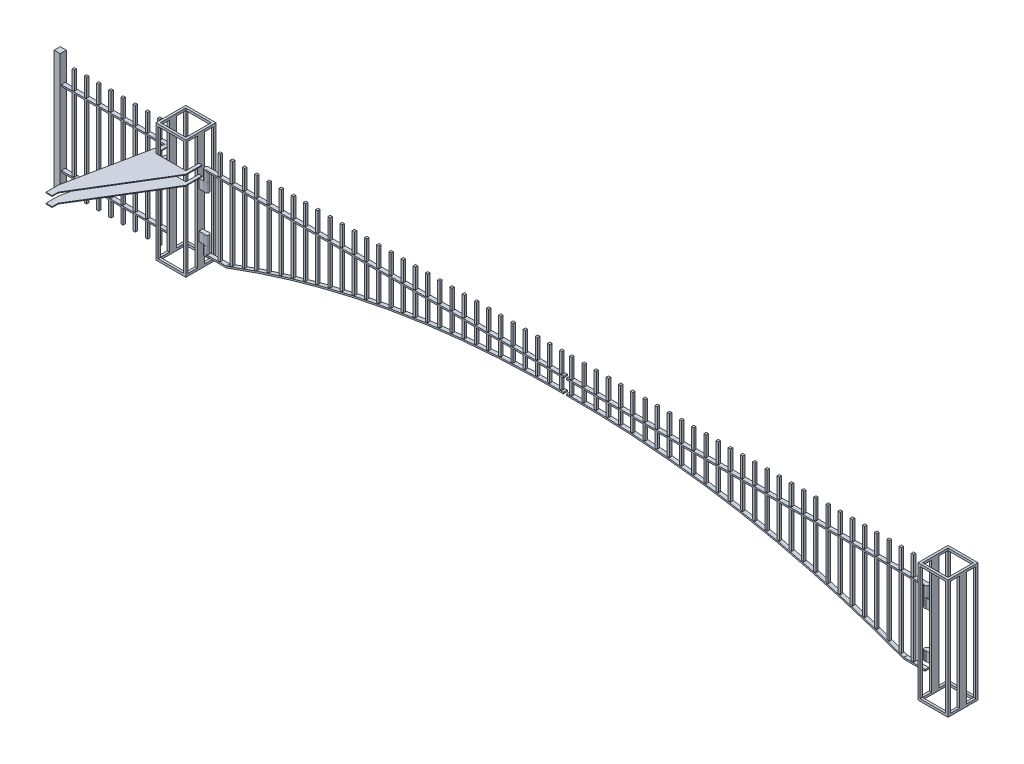
from build123d import *

# Parameters (mm, degrees)
SKETCH1_W                 = 19.05
SKETCH1_H                 = 60
BOSS_EXTRUDE1_DEPTH       = 990.6
SKETCH1_H_2               = 19.05
BOSS_EXTRUDE1_2_DEPTH     = 990.6
BOSS_EXTRUDE1_3_DEPTH     = 990.6
BOSS_EXTRUDE1_4_DEPTH     = 990.6
BOSS_EXTRUDE1_5_DEPTH     = 990.6
BOSS_EXTRUDE1_6_DEPTH     = 990.6
SKETCH1_W_2               = 50.8
SKETCH1_H_3               = 50.8
BOSS_EXTRUDE1_7_DEPTH     = 990.6
BOSS_EXTRUDE2_START       = 971.55
BOSS_EXTRUDE2_OUTLINE_W   = 211.9
BOSS_EXTRUDE2_OUTLINE_H   = 19.05
BOSS_EXTRUDE2_OUTLINE_W_2 = 19.05
BOSS_EXTRUDE2_OUTLINE_H_2 = 75.95
BOSS_EXTRUDE2_DEPTH       = 19.05
SKETCH1_4_W               = 250
SKETCH1_4_H               = 250
SKETCH1_4_W_2             = 211.9
SKETCH1_4_H_2             = 211.9
BOSS_EXTRUDE3_DEPTH       = 19.05
SKETCH1_5_W               = 19.05
SKETCH1_5_H               = 19.05
BOSS_EXTRUDE4_DEPTH       = 914.4
BOSS_EXTRUDE4_2_DEPTH     = 914.4
BOSS_EXTRUDE4_3_DEPTH     = 914.4
BOSS_EXTRUDE4_4_DEPTH     = 914.4
BOSS_EXTRUDE4_5_DEPTH     = 914.4
BOSS_EXTRUDE4_6_DEPTH     = 914.4
BOSS_EXTRUDE4_7_DEPTH     = 914.4
BOSS_EXTRUDE4_8_DEPTH     = 914.4
BOSS_EXTRUDE5_START       = 130
SKETCH2_W                 = 895.35
SKETCH2_H                 = 31.75
BOSS_EXTRUDE5_DEPTH       = 12.7
BOSS_EXTRUDE6_START       = 750
SKETCH2_2_W               = 895.35
SKETCH2_2_H               = 31.75
BOSS_EXTRUDE6_DEPTH       = 12.7
BOSS_EXTRUDE7_START       = -406.4
BOSS_EXTRUDE7_DEPTH       = 76.2
BOSS_EXTRUDE11_START      = -787.4
BOSS_EXTRUDE11_DEPTH      = 76.2
BOSS_EXTRUDE8_START       = -330.2
SKETCH5_3_R               = 19.05
BOSS_EXTRUDE8_DEPTH       = 76.2
BOSS_EXTRUDE12_START      = -787.4
SKETCH5_7_R               = 19.05
BOSS_EXTRUDE12_DEPTH      = 76.2
BOSS_EXTRUDE9_START       = -254
SKETCH5_4_W               = 19.05
SKETCH5_4_H               = 19.05
BOSS_EXTRUDE9_DEPTH       = 12.7
EXTRUDE_THIN1_START       = -15.875
EXTRUDE_THIN1_DEPTH       = 31.75
BOSS_EXTRUDE10_START      = -76.2
SKETCH5_5_W               = 19.05
SKETCH5_5_H               = 19.05
BOSS_EXTRUDE10_DEPTH      = 914.4
CUT_EXTRUDE1_DEPTH        = 4361.014057603
CUT_EXTRUDE1_DEPTH_BACK   = 4361.014057603
BOSS_EXTRUDE14_DEPTH      = 6.35
BOSS_EXTRUDE15_START      = -73.5
BOSS_EXTRUDE15_DEPTH      = 6.35


# Read off the part's stored shape, not the designer's step: Boss-Extrude2, Extrude-Thin1
with BuildPart() as part:
    # Sketch1 → Boss-Extrude1 (new body)
    with BuildSketch(Plane(origin=(0, 0, 0), x_dir=(1, 0, 0), z_dir=(0, 1, 0))):
        with Locations((-3288.475, 0)):
            Rectangle(SKETCH1_W, SKETCH1_H)
    extrude(amount=BOSS_EXTRUDE1_DEPTH)



with BuildPart() as body_2:
    # Sketch1 → Boss-Extrude1 2 (new body)
    with BuildSketch(Plane(origin=(0, 0, 0), x_dir=(1, 0, 0), z_dir=(0, 1, 0))):
        with Locations((-3288.475, 115.475)):
            Rectangle(SKETCH1_W, SKETCH1_H_2)
    extrude(amount=BOSS_EXTRUDE1_2_DEPTH)


with BuildPart() as body_3:
    # Sketch1 → Boss-Extrude1 3 (new body)
    with BuildSketch(Plane(origin=(0, 0, 0), x_dir=(1, 0, 0), z_dir=(0, 1, 0))):
        with Locations((-3288.475, -115.475)):
            Rectangle(SKETCH1_W, SKETCH1_H_2)
    extrude(amount=BOSS_EXTRUDE1_3_DEPTH)


with BuildPart() as body_4:
    # Sketch1 → Boss-Extrude1 4 (new body)
    with BuildSketch(Plane(origin=(0, 0, 0), x_dir=(1, 0, 0), z_dir=(0, 1, 0))):
        with Locations((-3057.525, 115.475)):
            Rectangle(SKETCH1_W, SKETCH1_H_2)
    extrude(amount=BOSS_EXTRUDE1_4_DEPTH)


with BuildPart() as body_5:
    # Sketch1 → Boss-Extrude1 5 (new body)
    with BuildSketch(Plane(origin=(0, 0, 0), x_dir=(1, 0, 0), z_dir=(0, 1, 0))):
        with Locations((-3057.525, 0)):
            Rectangle(SKETCH1_W, SKETCH1_H)
    extrude(amount=BOSS_EXTRUDE1_5_DEPTH)


with BuildPart() as body_6:
    # Sketch1 → Boss-Extrude1 6 (new body)
    with BuildSketch(Plane(origin=(0, 0, 0), x_dir=(1, 0, 0), z_dir=(0, 1, 0))):
        with Locations((-3057.525, -115.475)):
            Rectangle(SKETCH1_W, SKETCH1_H_2)
    extrude(amount=BOSS_EXTRUDE1_6_DEPTH)


with BuildPart() as body_7:
    # Sketch1 → Boss-Extrude1 7 (new body)
    with BuildSketch(Plane(origin=(0, 0, 0), x_dir=(1, 0, 0), z_dir=(0, 1, 0))):
        with Locations((-4218.75, 0)):
            Rectangle(SKETCH1_W_2, SKETCH1_H_3)
    extrude(amount=BOSS_EXTRUDE1_7_DEPTH)


with BuildPart() as part_1:
    add(part.part)

    add(body_2.part)  # Boss-Extrude2 merges body 2

    add(body_3.part)  # Boss-Extrude2 merges body 3

    add(body_4.part)  # Boss-Extrude2 merges body 4

    add(body_5.part)  # Boss-Extrude2 merges body 5

    add(body_6.part)  # Boss-Extrude2 merges body 6
    # Boss-Extrude2 outline → Boss-Extrude2 (add)
    with BuildSketch(Plane(origin=(0, 0, 0), x_dir=(1, 0, 0), z_dir=(0, 1, 0)).offset(BOSS_EXTRUDE2_START)):
        with Locations((-3173, 115.475)):
            Rectangle(BOSS_EXTRUDE2_OUTLINE_W, BOSS_EXTRUDE2_OUTLINE_H)
        with Locations((-3288.475, 67.975)):
            Rectangle(BOSS_EXTRUDE2_OUTLINE_W_2, BOSS_EXTRUDE2_OUTLINE_H_2)
        with Locations((-3057.525, 67.975)):
            Rectangle(BOSS_EXTRUDE2_OUTLINE_W_2, BOSS_EXTRUDE2_OUTLINE_H_2)
        with Locations((-3288.475, -67.975)):
            Rectangle(BOSS_EXTRUDE2_OUTLINE_W_2, BOSS_EXTRUDE2_OUTLINE_H_2)
        with Locations((-3057.525, -67.975)):
            Rectangle(BOSS_EXTRUDE2_OUTLINE_W_2, BOSS_EXTRUDE2_OUTLINE_H_2)
        with Locations((-3173, -115.475)):
            Rectangle(BOSS_EXTRUDE2_OUTLINE_W, BOSS_EXTRUDE2_OUTLINE_H)
    extrude(amount=BOSS_EXTRUDE2_DEPTH)

    # Sketch1<4> → Boss-Extrude3 (add)
    with BuildSketch(Plane(origin=(0, 0, 0), x_dir=(1, 0, 0), z_dir=(0, 1, 0))):
        with Locations((-3173, 0)):
            Rectangle(SKETCH1_4_W, SKETCH1_4_H)
        with Locations((-3173, 0)):
            Rectangle(SKETCH1_4_W_2, SKETCH1_4_H_2, mode=Mode.SUBTRACT)
    extrude(amount=BOSS_EXTRUDE3_DEPTH)

    # Sketch5 → Boss-Extrude7 (add)
    with BuildSketch(Plane(origin=(0, 990.6, 0), x_dir=(1, 0, 0), z_dir=(0, 1, 0)).offset(BOSS_EXTRUDE7_START)):
        with BuildLine():
            Line((-3007.730283709, 15.875), (-3048, 15.875))
            Line((-3048, 15.875), (-3048, -15.875))
            Line((-3048, -15.875), (-3007.730283709, -15.875))
            ThreePointArc((-3007.730283709, -15.875), (-2978.15, 0), (-3007.730283709, 15.875))
        make_face()
    extrude(amount=BOSS_EXTRUDE7_DEPTH)

    # Sketch5<6> → Boss-Extrude11 (add)
    with BuildSketch(Plane(origin=(0, 990.6, 0), x_dir=(1, 0, 0), z_dir=(0, 1, 0)).offset(BOSS_EXTRUDE11_START)):
        with BuildLine():
            Line((-3007.730283709, 15.875), (-3048, 15.875))
            Line((-3048, 15.875), (-3048, -15.875))
            Line((-3048, -15.875), (-3007.730283709, -15.875))
            ThreePointArc((-3007.730283709, -15.875), (-2978.15, 0), (-3007.730283709, 15.875))
        make_face()
    extrude(amount=BOSS_EXTRUDE11_DEPTH)


with BuildPart() as body_3_2:
    # Sketch1<5> → Boss-Extrude4 (new body)
    with BuildSketch(Plane(origin=(0, 0, 0), x_dir=(1, 0, 0), z_dir=(0, 1, 0))):
        with Locations((-3491.675, 0)):
            Rectangle(SKETCH1_5_W, SKETCH1_5_H)
    extrude(amount=BOSS_EXTRUDE4_DEPTH)


with BuildPart() as body_4_2:
    # Sketch1<5> → Boss-Extrude4 2 (new body)
    with BuildSketch(Plane(origin=(0, 0, 0), x_dir=(1, 0, 0), z_dir=(0, 1, 0))):
        with Locations((-3390.075, 0)):
            Rectangle(SKETCH1_5_W, SKETCH1_5_H)
    extrude(amount=BOSS_EXTRUDE4_2_DEPTH)


    add(body_3_2.part)  # Boss-Extrude5 merges body 3 2


with BuildPart() as body_5_2:
    # Sketch1<5> → Boss-Extrude4 3 (new body)
    with BuildSketch(Plane(origin=(0, 0, 0), x_dir=(1, 0, 0), z_dir=(0, 1, 0))):
        with Locations((-3593.275, 0)):
            Rectangle(SKETCH1_5_W, SKETCH1_5_H)
    extrude(amount=BOSS_EXTRUDE4_3_DEPTH)


with BuildPart() as body_6_2:
    # Sketch1<5> → Boss-Extrude4 4 (new body)
    with BuildSketch(Plane(origin=(0, 0, 0), x_dir=(1, 0, 0), z_dir=(0, 1, 0))):
        with Locations((-3694.875, 0)):
            Rectangle(SKETCH1_5_W, SKETCH1_5_H)
    extrude(amount=BOSS_EXTRUDE4_4_DEPTH)


with BuildPart() as body_7_2:
    # Sketch1<5> → Boss-Extrude4 5 (new body)
    with BuildSketch(Plane(origin=(0, 0, 0), x_dir=(1, 0, 0), z_dir=(0, 1, 0))):
        with Locations((-3796.475, 0)):
            Rectangle(SKETCH1_5_W, SKETCH1_5_H)
    extrude(amount=BOSS_EXTRUDE4_5_DEPTH)


with BuildPart() as body_8:
    # Sketch1<5> → Boss-Extrude4 6 (new body)
    with BuildSketch(Plane(origin=(0, 0, 0), x_dir=(1, 0, 0), z_dir=(0, 1, 0))):
        with Locations((-3898.075, 0)):
            Rectangle(SKETCH1_5_W, SKETCH1_5_H)
    extrude(amount=BOSS_EXTRUDE4_6_DEPTH)


with BuildPart() as body_9:
    # Sketch1<5> → Boss-Extrude4 7 (new body)
    with BuildSketch(Plane(origin=(0, 0, 0), x_dir=(1, 0, 0), z_dir=(0, 1, 0))):
        with Locations((-3999.675, 0)):
            Rectangle(SKETCH1_5_W, SKETCH1_5_H)
    extrude(amount=BOSS_EXTRUDE4_7_DEPTH)


with BuildPart() as body_10:
    # Sketch1<5> → Boss-Extrude4 8 (new body)
    with BuildSketch(Plane(origin=(0, 0, 0), x_dir=(1, 0, 0), z_dir=(0, 1, 0))):
        with Locations((-4101.275, 0)):
            Rectangle(SKETCH1_5_W, SKETCH1_5_H)
    extrude(amount=BOSS_EXTRUDE4_8_DEPTH)


with BuildPart() as body_4_2_1:
    add(body_4_2.part)

    add(body_5_2.part)  # Boss-Extrude5 merges body 5 2

    add(body_6_2.part)  # Boss-Extrude5 merges body 6 2

    add(body_7_2.part)  # Boss-Extrude5 merges body 7 2

    add(body_8.part)  # Boss-Extrude5 merges body 8

    add(body_9.part)  # Boss-Extrude5 merges body 9

    add(body_10.part)  # Boss-Extrude5 merges body 10

    add(body_7.part)  # Boss-Extrude5 merges body 7
    # Sketch2 → Boss-Extrude5 (add)
    with BuildSketch(Plane(origin=(0, 0, 0), x_dir=(1, 0, 0), z_dir=(0, 1, 0)).offset(BOSS_EXTRUDE5_START)):
        with Locations((-3745.675, 0)):
            Rectangle(SKETCH2_W, SKETCH2_H)
    extrude(amount=BOSS_EXTRUDE5_DEPTH)

    # Sketch2<2> → Boss-Extrude6 (add)
    with BuildSketch(Plane(origin=(0, 0, 0), x_dir=(1, 0, 0), z_dir=(0, 1, 0)).offset(BOSS_EXTRUDE6_START)):
        with Locations((-3745.675, 0)):
            Rectangle(SKETCH2_2_W, SKETCH2_2_H)
    extrude(amount=BOSS_EXTRUDE6_DEPTH)


    add(part_1.part)  # Boss-Extrude15 merges part
    # Sketch3<2> → Boss-Extrude15 (add)
    with BuildSketch(Plane(origin=(0, 762.7, 0), x_dir=(1, 0, 0), z_dir=(0, 1, 0)).offset(BOSS_EXTRUDE15_START)):
        Polygon((-3298, -15.875), (-3323.4, -15.875), (-3475.8, -760), (-3475.8, -861.6), (-3425, -861.6), (-3425, -810.8), (-3022.6, -150.4), (-3022.6, -15.875), (-3048, -15.875), (-3048, -125), (-3298, -125), align=None)
    extrude(amount=-BOSS_EXTRUDE15_DEPTH)


with BuildPart() as body_3_3:
    # Sketch5<3> → Boss-Extrude8 (new body)
    with BuildSketch(Plane(origin=(0, 990.6, 0), x_dir=(1, 0, 0), z_dir=(0, 1, 0)).offset(BOSS_EXTRUDE8_START)):
        with Locations(Location((-2997.2, 0, 0), (0, 0, 90))):
            Circle(SKETCH5_3_R)
    extrude(amount=BOSS_EXTRUDE8_DEPTH)

    # Sketch5<4> → Boss-Extrude9 (add)
    with BuildSketch(Plane(origin=(0, 990.6, 0), x_dir=(1, 0, 0), z_dir=(0, 1, 0)).offset(BOSS_EXTRUDE9_START)):
        with BuildLine():
            ThreePointArc((-2986.669716291, 15.875), (-3016.25, 0), (-2986.669716291, -15.875))
            Line((-2986.669716291, -15.875), (-12.7, -15.875))
            Line((-12.7, -15.875), (-12.7, 15.875))
            Line((-12.7, 15.875), (-2986.669716291, 15.875))
        make_face()
        with Locations((-41.275, 0)):
            Rectangle(SKETCH5_4_W, SKETCH5_4_H, mode=Mode.SUBTRACT)
        with Locations((-2886.075, 0)):
            Rectangle(SKETCH5_4_W, SKETCH5_4_H, mode=Mode.SUBTRACT)
        with Locations((-2784.475, 0)):
            Rectangle(SKETCH5_4_W, SKETCH5_4_H, mode=Mode.SUBTRACT)
        with Locations((-2682.875, 0)):
            Rectangle(SKETCH5_4_W, SKETCH5_4_H, mode=Mode.SUBTRACT)
        with Locations((-2581.275, 0)):
            Rectangle(SKETCH5_4_W, SKETCH5_4_H, mode=Mode.SUBTRACT)
        with Locations((-2479.675, 0)):
            Rectangle(SKETCH5_4_W, SKETCH5_4_H, mode=Mode.SUBTRACT)
        with Locations((-2378.075, 0)):
            Rectangle(SKETCH5_4_W, SKETCH5_4_H, mode=Mode.SUBTRACT)
        with Locations((-2276.475, 0)):
            Rectangle(SKETCH5_4_W, SKETCH5_4_H, mode=Mode.SUBTRACT)
        with Locations((-2174.875, 0)):
            Rectangle(SKETCH5_4_W, SKETCH5_4_H, mode=Mode.SUBTRACT)
        with Locations((-2073.275, 0)):
            Rectangle(SKETCH5_4_W, SKETCH5_4_H, mode=Mode.SUBTRACT)
        with Locations((-1971.675, 0)):
            Rectangle(SKETCH5_4_W, SKETCH5_4_H, mode=Mode.SUBTRACT)
        with Locations((-1870.075, 0)):
            Rectangle(SKETCH5_4_W, SKETCH5_4_H, mode=Mode.SUBTRACT)
        with Locations((-1768.475, 0)):
            Rectangle(SKETCH5_4_W, SKETCH5_4_H, mode=Mode.SUBTRACT)
        with Locations((-1666.875, 0)):
            Rectangle(SKETCH5_4_W, SKETCH5_4_H, mode=Mode.SUBTRACT)
        with Locations((-1565.275, 0)):
            Rectangle(SKETCH5_4_W, SKETCH5_4_H, mode=Mode.SUBTRACT)
        with Locations((-1463.675, 0)):
            Rectangle(SKETCH5_4_W, SKETCH5_4_H, mode=Mode.SUBTRACT)
        with Locations((-1362.075, 0)):
            Rectangle(SKETCH5_4_W, SKETCH5_4_H, mode=Mode.SUBTRACT)
        with Locations((-1260.475, 0)):
            Rectangle(SKETCH5_4_W, SKETCH5_4_H, mode=Mode.SUBTRACT)
        with Locations((-1158.875, 0)):
            Rectangle(SKETCH5_4_W, SKETCH5_4_H, mode=Mode.SUBTRACT)
        with Locations((-1057.275, 0)):
            Rectangle(SKETCH5_4_W, SKETCH5_4_H, mode=Mode.SUBTRACT)
        with Locations((-955.675, 0)):
            Rectangle(SKETCH5_4_W, SKETCH5_4_H, mode=Mode.SUBTRACT)
        with Locations((-854.075, 0)):
            Rectangle(SKETCH5_4_W, SKETCH5_4_H, mode=Mode.SUBTRACT)
        with Locations((-752.475, 0)):
            Rectangle(SKETCH5_4_W, SKETCH5_4_H, mode=Mode.SUBTRACT)
        with Locations((-650.875, 0)):
            Rectangle(SKETCH5_4_W, SKETCH5_4_H, mode=Mode.SUBTRACT)
        with Locations((-549.275, 0)):
            Rectangle(SKETCH5_4_W, SKETCH5_4_H, mode=Mode.SUBTRACT)
        with Locations((-447.675, 0)):
            Rectangle(SKETCH5_4_W, SKETCH5_4_H, mode=Mode.SUBTRACT)
        with Locations((-346.075, 0)):
            Rectangle(SKETCH5_4_W, SKETCH5_4_H, mode=Mode.SUBTRACT)
        with Locations((-244.475, 0)):
            Rectangle(SKETCH5_4_W, SKETCH5_4_H, mode=Mode.SUBTRACT)
        with Locations((-142.875, 0)):
            Rectangle(SKETCH5_4_W, SKETCH5_4_H, mode=Mode.SUBTRACT)
    extrude(amount=BOSS_EXTRUDE9_DEPTH)



with BuildPart() as body_4_3:
    # Sketch5<7> → Boss-Extrude12 (new body)
    with BuildSketch(Plane(origin=(0, 990.6, 0), x_dir=(1, 0, 0), z_dir=(0, 1, 0)).offset(BOSS_EXTRUDE12_START)):
        with Locations(Location((-2997.2, 0, 0), (0, 0, 270))):
            Circle(SKETCH5_7_R)
    extrude(amount=-BOSS_EXTRUDE12_DEPTH)


with BuildPart() as body_5_3:
    # Extrude-Thin1 outline → Extrude-Thin1 (new body)
    with BuildSketch(Plane.XY.offset(EXTRUDE_THIN1_START)):
        with BuildLine():
            Line((-2997.2, 127), (-2819.4, 127))
            add(Edge.make_bspline(
                [(-2819.4, 127), (-1473.440102285, 635.310682922), (-12.7, 622.3)],
                knots=[0, 0, 0, 1, 1, 1], degree=2))
            Line((-12.7, 622.3), (-12.58688671, 634.999496265))
            add(Edge.make_bspline(
                [(-2821.717245495, 139.7), (-2372.667601337, 309.134996515), (-1914.022815578, 435.135459322), (-977.619173426, 600.237772857), (-499.861687645, 639.339609829), (-12.58688671, 634.999496265)],
                knots=[0, 0, 0, 0, 0.5, 0.5, 1, 1, 1, 1], degree=3))
            Line((-2821.717245495, 139.7), (-2997.2, 139.7))
            Line((-2997.2, 139.7), (-2997.2, 127))
        make_face()
    extrude(amount=EXTRUDE_THIN1_DEPTH)


with BuildPart() as body_3_3_1:
    add(body_3_3.part)

    add(body_5_3.part)  # Boss-Extrude10 merges body 5 3
    # Sketch5<5> → Boss-Extrude10 (add)
    with BuildSketch(Plane(origin=(0, 990.6, 0), x_dir=(1, 0, 0), z_dir=(0, 1, 0)).offset(BOSS_EXTRUDE10_START)):
        with Locations((-1463.675, 0)):
            Rectangle(SKETCH5_5_W, SKETCH5_5_H)
        with Locations((-1057.275, 0)):
            Rectangle(SKETCH5_5_W, SKETCH5_5_H)
        with Locations((-955.675, 0)):
            Rectangle(SKETCH5_5_W, SKETCH5_5_H)
        with Locations((-854.075, 0)):
            Rectangle(SKETCH5_5_W, SKETCH5_5_H)
        with Locations((-752.475, 0)):
            Rectangle(SKETCH5_5_W, SKETCH5_5_H)
        with Locations((-650.875, 0)):
            Rectangle(SKETCH5_5_W, SKETCH5_5_H)
        with Locations((-549.275, 0)):
            Rectangle(SKETCH5_5_W, SKETCH5_5_H)
        with Locations((-447.675, 0)):
            Rectangle(SKETCH5_5_W, SKETCH5_5_H)
        with Locations((-346.075, 0)):
            Rectangle(SKETCH5_5_W, SKETCH5_5_H)
        with Locations((-244.475, 0)):
            Rectangle(SKETCH5_5_W, SKETCH5_5_H)
        with Locations((-142.875, 0)):
            Rectangle(SKETCH5_5_W, SKETCH5_5_H)
        with Locations((-2886.075, 0)):
            Rectangle(SKETCH5_5_W, SKETCH5_5_H)
        with Locations((-2784.475, 0)):
            Rectangle(SKETCH5_5_W, SKETCH5_5_H)
        with Locations((-2682.875, 0)):
            Rectangle(SKETCH5_5_W, SKETCH5_5_H)
        with Locations((-2581.275, 0)):
            Rectangle(SKETCH5_5_W, SKETCH5_5_H)
        with Locations((-2479.675, 0)):
            Rectangle(SKETCH5_5_W, SKETCH5_5_H)
        with Locations((-2378.075, 0)):
            Rectangle(SKETCH5_5_W, SKETCH5_5_H)
        with Locations((-2276.475, 0)):
            Rectangle(SKETCH5_5_W, SKETCH5_5_H)
        with Locations((-2174.875, 0)):
            Rectangle(SKETCH5_5_W, SKETCH5_5_H)
        with Locations((-2073.275, 0)):
            Rectangle(SKETCH5_5_W, SKETCH5_5_H)
        with Locations((-1971.675, 0)):
            Rectangle(SKETCH5_5_W, SKETCH5_5_H)
        with Locations((-1870.075, 0)):
            Rectangle(SKETCH5_5_W, SKETCH5_5_H)
        with Locations((-1768.475, 0)):
            Rectangle(SKETCH5_5_W, SKETCH5_5_H)
        with Locations((-1666.875, 0)):
            Rectangle(SKETCH5_5_W, SKETCH5_5_H)
        with Locations((-1565.275, 0)):
            Rectangle(SKETCH5_5_W, SKETCH5_5_H)
        with Locations((-1362.075, 0)):
            Rectangle(SKETCH5_5_W, SKETCH5_5_H)
        with Locations((-1260.475, 0)):
            Rectangle(SKETCH5_5_W, SKETCH5_5_H)
        with Locations((-1158.875, 0)):
            Rectangle(SKETCH5_5_W, SKETCH5_5_H)
        with Locations((-41.275, 0)):
            Rectangle(SKETCH5_5_W, SKETCH5_5_H)
    extrude(amount=-BOSS_EXTRUDE10_DEPTH)

    # Sketch6<3> → Cut-Extrude1 (cut, two sides: drawn at the far end of the back side and taken through both)
    with BuildSketch(Plane.XY.offset(-CUT_EXTRUDE1_DEPTH_BACK)):
        with BuildLine():
            add(Edge.make_bspline(
                [(-2819.4, 127), (-1473.440102285, 635.310682922), (-12.7, 622.3)],
                knots=[0, 0, 0, 1, 1, 1], degree=2))
            Line((-12.7, 622.3), (0, -557.715822447))
            Line((0, -557.715822447), (-2997.2, -181.386379714))
            Line((-2997.2, -181.386379714), (-2997.2, 127))
            Line((-2997.2, 127), (-2819.4, 127))
        make_face()
    extrude(amount=CUT_EXTRUDE1_DEPTH + CUT_EXTRUDE1_DEPTH_BACK, mode=Mode.SUBTRACT)


with BuildPart() as body_5_4:
    # Mirror1: mirrored copy
    add(body_3_3_1.part.mirror(Plane(origin=(0, 0, 0), x_dir=(0, 0, 1), z_dir=(1, 0, 0))))


with BuildPart() as body_6_3:
    # Mirror1 2: mirrored copy
    add(part_1.part.mirror(Plane(origin=(0, 0, 0), x_dir=(0, 0, 1), z_dir=(1, 0, 0))))


with BuildPart() as body_7_3:
    # Sketch3 → Boss-Extrude14 (new body)
    with BuildSketch(Plane(origin=(0, 762.7, 0), x_dir=(1, 0, 0), z_dir=(0, 1, 0))):
        Polygon((-3298, -15.875), (-3323.4, -15.875), (-3475.8, -760), (-3475.8, -861.6), (-3425, -861.6), (-3425, -810.8), (-3022.6, -150.4), (-3022.6, -15.875), (-3048, -15.875), (-3048, -125), (-3298, -125), align=None)
    extrude(amount=BOSS_EXTRUDE14_DEPTH)


solid = Compound([body_4_2_1.part, body_4_3.part, body_3_3_1.part, body_5_4.part, body_6_3.part, body_7_3.part])
